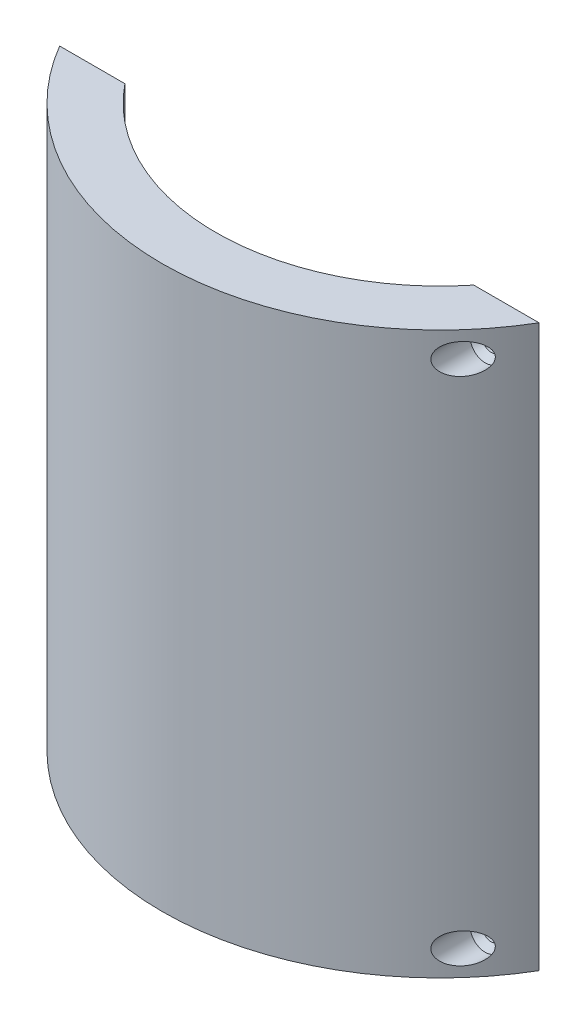
from build123d import *

# Parameters (mm, degrees)
BOSS_EXTRUDE1_DEPTH = 100


with BuildPart() as part:
    # Sketch1 → Boss-Extrude1 (new body)
    with BuildSketch(Plane(origin=(0, 0, 0), x_dir=(1, 0, 0), z_dir=(0, 1, 0))):
        with BuildLine():
            ThreePointArc((31.086694629, -25.07), (0, -39.936042405), (-31.086694629, -25.07))
            Line((-31.086694629, -25.07), (-42.716694629, -25.07))
            ThreePointArc((-42.716694629, -25.07), (0, -49.53), (42.716694629, -25.07))
            Line((42.716694629, -25.07), (31.086694629, -25.07))
        make_face()
    extrude(amount=BOSS_EXTRUDE1_DEPTH)

    # Sketch6 → Cut-Revolve4 (revolve, cut)
    with BuildSketch(Plane(origin=(36.901694629, 4.5125, 25.07), x_dir=(-1, 0, 0), z_dir=(0, -1, 0))):
        Polygon((0, 1.685394277), (0, -4.78184701), (0, -15.185924704), (-2.7, -15.185924704), (-2.7, -3.777717266), (-1.6, -2.724303815), (-1.6, 1.685394277), align=None)
    cut_revolve4 = revolve(axis=Axis((36.901694629, 4.5125, 23.384605723), (0, 0, 1)), mode=Mode.SUBTRACT)

    # Mirror1: Cut-Revolve4 across plane
    add(cut_revolve4.mirror(Plane(origin=(0, 50, 0), x_dir=(0, 0, 1), z_dir=(0, -1, 0))), mode=Mode.SUBTRACT)

    # Mirror1 at the second plane: Cut-Revolve4 across plane
    add(cut_revolve4.mirror(Plane(origin=(0, 0, 0), x_dir=(0, 0, 1), z_dir=(1, 0, 0))), mode=Mode.SUBTRACT)

    # Mirror1 at the second plane copy 1 sketc → Mirror1 at the second plane copy 1 (revolve, cut)
    with BuildSketch(Plane(origin=(-36.901694629, 95.4875, 25.07), x_dir=(1, 0, 0), z_dir=(0, 1, 0))):
        Polygon((0, 1.685394277), (0, -4.78184701), (0, -15.185924704), (-2.7, -15.185924704), (-2.7, -3.777717266), (-1.6, -2.724303815), (-1.6, 1.685394277), align=None)
    revolve(axis=Axis((-36.901694629, 95.4875, 23.384605723), (0, 0, 1)), mode=Mode.SUBTRACT)


solid = part.part
